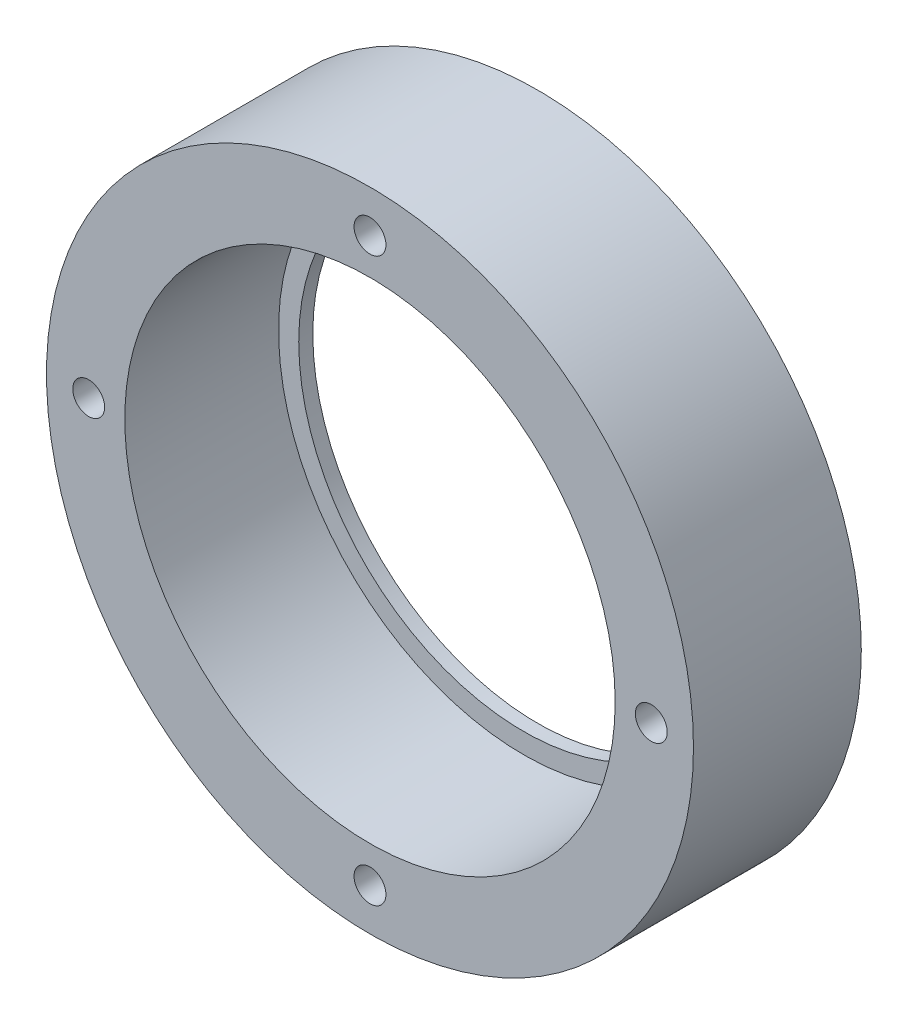
from build123d import *

# Parameters (mm, degrees)
SKETCH1_R           = 34.5
SKETCH1_R_2         = 24
BOSS_EXTRUDE1_DEPTH = 1.5
SKETCH3_R           = 34.5
SKETCH3_R_2         = 26.15
BOSS_EXTRUDE2_DEPTH = 16.4
SKETCH4_R           = 1.7
CUT_EXTRUDE1_DEPTH  = 52.970279968
CHAMFER1_SIZE       = 0.4


with BuildPart() as part:
    # Sketch1 → Boss-Extrude1 (new body)
    with BuildSketch(Plane.XY):
        Circle(SKETCH1_R)
        Circle(SKETCH1_R_2, mode=Mode.SUBTRACT)
    extrude(amount=BOSS_EXTRUDE1_DEPTH)

    # Sketch3 → Boss-Extrude2 (add)
    with BuildSketch(Plane.XY.offset(1.5)):
        Circle(SKETCH3_R)
        Circle(SKETCH3_R_2, mode=Mode.SUBTRACT)
    extrude(amount=BOSS_EXTRUDE2_DEPTH)

    # Sketch4 → Cut-Extrude1 (cut, through all)
    with BuildSketch(Plane.XY.offset(17.9)):
        with Locations((0, 30)):
            Circle(SKETCH4_R)
        with Locations((30, 0)):
            Circle(SKETCH4_R)
        with Locations((0, -30)):
            Circle(SKETCH4_R)
        with Locations((-30, 0)):
            Circle(SKETCH4_R)
    extrude(amount=-CUT_EXTRUDE1_DEPTH, mode=Mode.SUBTRACT)

    # Chamfer1
    chamfer1_edges = [part.edges().sort_by_distance(p)[0] for p in [
        (-1.7, -30, 0),
        (28.3, 0, 0),
        (-31.7, 0, 0),
        (-1.7, 30, 0),
    ]]
    chamfer(chamfer1_edges, length=CHAMFER1_SIZE)


solid = part.part
